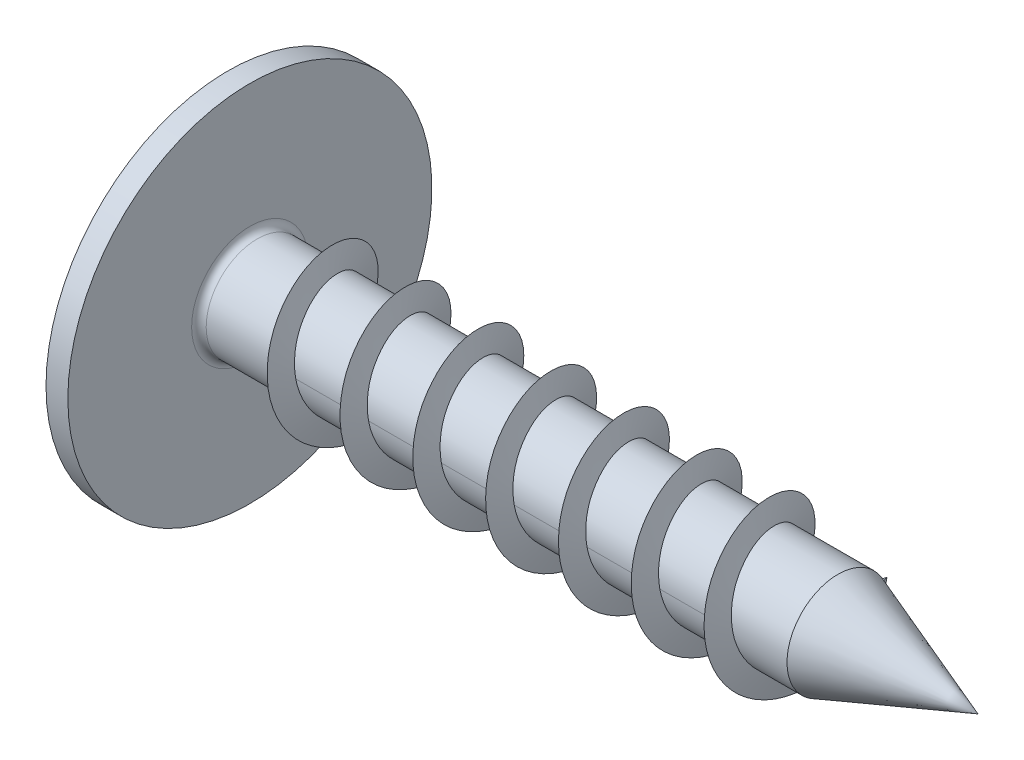
from build123d import *

# Parameters (mm, degrees)
FILLET1_R       = 0.1
RECPAT_COUNT    = 2
RECPAT_ANGLE    = 90
BALAYAGE1_PITCH = 1


with BuildPart() as part:
    # BodySke → Base-Revolve (revolve)
    with BuildSketch(Plane.XY, mode=Mode.PRIVATE) as base_revolve_sk:
        with BuildLine():
            Line((1.3, 0.7), (1.3, 2.5))
            Line((1.3, 2.5), (1, 2.5))
            Line((1, 2.5), (1, 1.75))
            Line((1, 1.75), (0.620174425, 1.75))
            ThreePointArc((0.620174425, 1.75), (0.531980628, 1.726913525), (0.466409986, 1.663576159))
            ThreePointArc((0.466409986, 1.663576159), (0.118808019, 0.863861087), (0, 0))
            Line((0, 0), (11.3, 0))
            Line((11.3, 0), (9.376765806, 0.7))
            Line((9.376765806, 0.7), (1.3, 0.7))
        make_face()
    revolve(base_revolve_sk.sketch.rotate(Axis((-25.4, 0, 0), (1, 0, 0)), 90), axis=Axis((-25.4, 0, 0), (1, 0, 0)))

    # Fillet1
    fillet1_edges = [part.edges().sort_by_distance(p)[0] for p in [
        (1.3, 0, -0.7),
    ]]
    fillet(fillet1_edges, radius=FILLET1_R)

    # Sketch3 → Recess section 0
    with BuildSketch(Plane(origin=(0, 0, 0), x_dir=(0, 0, -1), z_dir=(1, 0, 0))):
        with BuildLine():
            Line((0.24, -1.05), (-0.24, -1.05))
            Line((-0.24, -1.05), (-0.24, 1.05))
            Line((-0.24, 1.05), (0.24, 1.05))
            Line((0.24, 1.05), (0.24, -1.05))
        make_face()
    # Sketch4 → Recess section 1
    with BuildSketch(Plane(origin=(1.42, 0, 0), x_dir=(0, 0, -1), z_dir=(1, 0, 0))):
        with BuildLine():
            Line((0.24, -0.342014235), (-0.24, -0.342014235))
            Line((-0.24, -0.342014235), (-0.24, 0.342014235))
            Line((-0.24, 0.342014235), (0.24, 0.342014235))
            Line((0.24, 0.342014235), (0.24, -0.342014235))
        make_face()
    recess = loft(mode=Mode.SUBTRACT)

    # RecPat: Recess ×2 about axis
    recpat_axis = Axis((0, 0, 0), (1, 0, 0))
    for i in range(1, RECPAT_COUNT):
        add(recess.rotate(recpat_axis, i * RECPAT_ANGLE / (RECPAT_COUNT - 1)), mode=Mode.SUBTRACT)

    # RecCorSke → RecessCore (revolve, cut)
    with BuildSketch(Plane.XY, mode=Mode.PRIVATE) as recesscore_sk:
        Polygon((0, 0), (0, 0.454796073), (1.42, 0.3555), (1.535508952, 0), align=None)
    revolve(recesscore_sk.sketch.rotate(Axis((-3.175, 0, 0), (1, 0, 0)), 13.894577695), axis=Axis((-3.175, 0, 0), (1, 0, 0)), mode=Mode.SUBTRACT)

    # Balayage1: the profile of Esquisse2 profile screwed along a right-hand helix of 7.25 turns, 8 arcs to a turn; built about Z, then put on its axis
    balayage1_z = Axis((0, 0, 0), (0, 0, 1))
    balayage1_corners = [(0.6997, 0, -0.080465142), (1, 0, 0), (0.6997, 0, 0.080465142)]
    with BuildLine(mode=Mode.PRIVATE) as balayage1_profile:
        Line(balayage1_corners[0], balayage1_corners[1])
        Line(balayage1_corners[1], balayage1_corners[2])
        Line(balayage1_corners[2], balayage1_corners[0])
    balayage1_cap = Face(balayage1_profile.wire())
    balayage1_turn_angles = [0, 22.5, 45, 67.5, 90, 112.5, 135, 157.5, 180, 202.5, 225, 247.5, 270, 292.5, 315, 337.5, 360]
    balayage1_turn_weights = [1, 0.9238795325112867, 1, 0.9238795325112867, 1, 0.9238795325112867, 1, 0.9238795325112867, 1, 0.9238795325112867, 1, 0.9238795325112867, 1, 0.9238795325112867, 1, 0.9238795325112867, 1]
    balayage1_turn_rails = [Edge.make_bspline([Vector(p[0], p[1], 0).rotate(balayage1_z, balayage1_turn_angles[k]) / balayage1_turn_weights[k] + Vector(0, 0, p[2] + BALAYAGE1_PITCH * balayage1_turn_angles[k] / 360) for k in range(17)], [0, 0, 0, 1, 1, 2, 2, 3, 3, 4, 4, 5, 5, 6, 6, 7, 7, 8, 8, 8], 2, balayage1_turn_weights) for p in balayage1_corners]
    balayage1_turn_sides = [Face.make_surface_from_curves(balayage1_turn_rails[p[0]], balayage1_turn_rails[p[1]]) for p in [(0, 1), (1, 2), (2, 0)]]
    balayage1_last_angles = [2520, 2542.5, 2565, 2587.5, 2610]
    balayage1_last_weights = [1, 0.9238795325112867, 1, 0.9238795325112731, 1]
    balayage1_last_rails = [Edge.make_bspline([Vector(p[0], p[1], 0).rotate(balayage1_z, balayage1_last_angles[k]) / balayage1_last_weights[k] + Vector(0, 0, p[2] + BALAYAGE1_PITCH * balayage1_last_angles[k] / 360) for k in range(5)], [0, 0, 0, 1, 1, 2, 2, 2], 2, balayage1_last_weights) for p in balayage1_corners]
    balayage1_last_sides = [Face.make_surface_from_curves(balayage1_last_rails[p[0]], balayage1_last_rails[p[1]]) for p in [(0, 1), (1, 2), (2, 0)]]
    balayage1 = Plane(origin=(1.8, 0, 0), x_dir=(0, -1, 0), z_dir=(1, 0, 0)) * Solid(Shell([*[p.moved(Location((0, 0, BALAYAGE1_PITCH * i))) for i in range(7) for p in balayage1_turn_sides], *balayage1_last_sides, balayage1_cap, balayage1_cap.rotate(balayage1_z, 2610).moved(Location((0, 0, BALAYAGE1_PITCH * 2610 / 360)))]))
    add(balayage1)


solid = part.part
